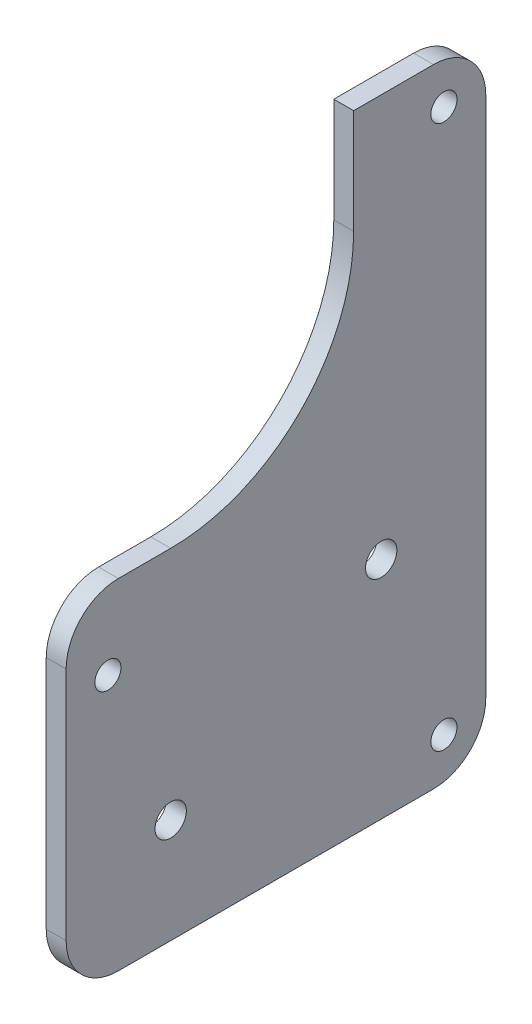
from build123d import *

# Parameters (mm, degrees)
SKETCH1_R           = 3
SKETCH1_R_2         = 2.5
BOSS_EXTRUDE1_DEPTH = 3.8
FILLET1_R           = 10


with BuildPart() as part:
    # Sketch1 → Boss-Extrude1 (new body)
    with BuildSketch(Plane(origin=(0, 0, 0), x_dir=(0, 0, -1), z_dir=(1, 0, 0))):
        with BuildLine():
            Line((-33.760087735, -70.625), (46.510087735, -70.625))
            Line((46.510087735, -70.625), (46.510087735, 49.375))
            Line((46.510087735, 49.375), (21.239912265, 49.375))
            Line((21.239912265, 49.375), (21.239912265, 29.375))
            ThreePointArc((21.239912265, 29.375), (10.988649606, 4.626262658), (-13.760087735, -5.625))
            Line((-13.760087735, -5.625), (-33.760087735, -5.625))
            Line((-33.760087735, -5.625), (-33.760087735, -70.625))
        make_face()
        with Locations((-13.760087735, -50.625)):
            Circle(SKETCH1_R, mode=Mode.SUBTRACT)
        with Locations((26.510087735, -27.575640625)):
            Circle(SKETCH1_R, mode=Mode.SUBTRACT)
        with Locations((38.510087735, 41.375)):
            Circle(SKETCH1_R_2, mode=Mode.SUBTRACT)
        with Locations((38.510087735, -62.625)):
            Circle(SKETCH1_R_2, mode=Mode.SUBTRACT)
        with Locations((-25.760087735, -20.625)):
            Circle(SKETCH1_R_2, mode=Mode.SUBTRACT)
    extrude(amount=BOSS_EXTRUDE1_DEPTH)

    # Fillet1
    fillet1_edges = [part.edges().sort_by_distance(p)[0] for p in [
        (1.9, -70.625, -46.510087735),
        (1.9, 49.375, -46.510087735),
        (1.9, -5.625, 33.760087735),
        (1.9, -70.625, 33.760087735),
    ]]
    fillet(fillet1_edges, radius=FILLET1_R)


solid = part.part
